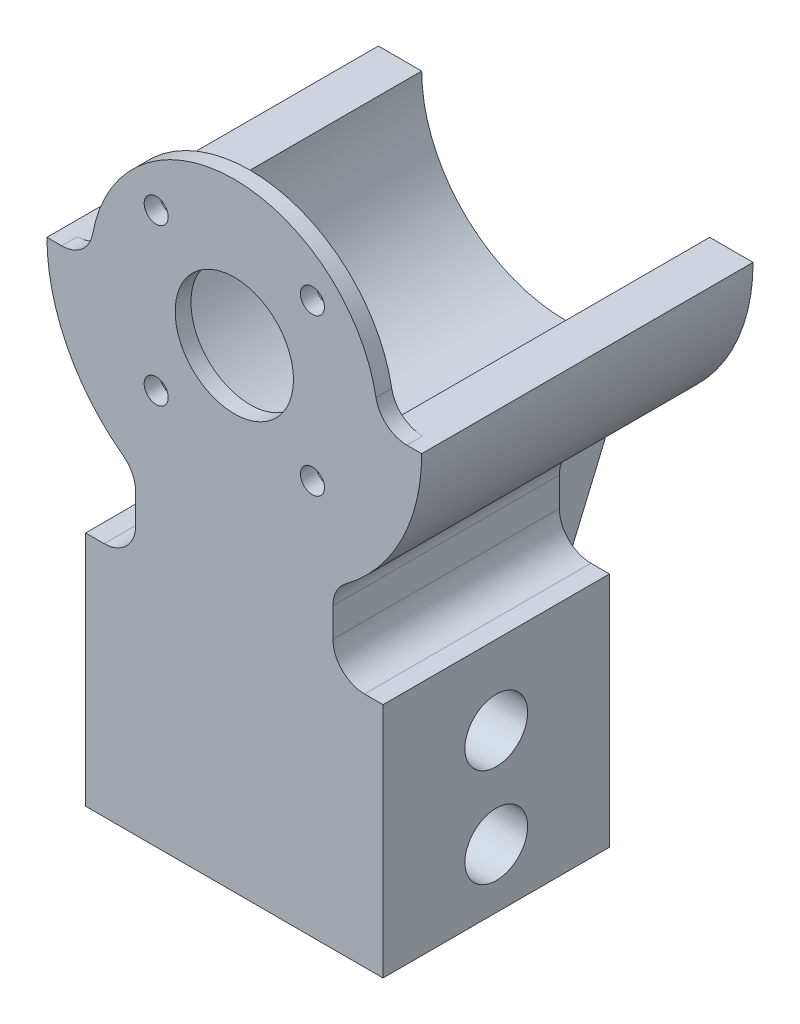
from build123d import *

# Parameters (mm, degrees)
SKETCH2_R               = 1.525
SKETCH2_R_2             = 7.5
BOSS_EXTRUDE3_DEPTH     = 2
BOSS_EXTRUDE4_START     = -40
BOSS_EXTRUDE4_DEPTH     = 42
BOSS_EXTRUDE6_START     = -30
SKETCH7_W               = 37.7
SKETCH7_H               = 28.7
SKETCH7_R               = 9.4
BOSS_EXTRUDE6_DEPTH     = 30
BOSS_EXTRUDE7_START     = -26.7
BOSS_EXTRUDE7_DEPTH     = 26.7
CUT_EXTRUDE1_DEPTH      = 76.921423195
CUT_EXTRUDE1_DEPTH_BACK = 76.921423195
SKETCH6_R               = 3.975
RIB3_START              = -5
RIB3_DEPTH              = 10
FILLET2_R               = 4


# Read off the part's stored shape, not the designer's step: Rib3
with BuildPart() as part:
    # Sketch2 → Boss-Extrude3 (new body)
    with BuildSketch(Plane.XY):
        with BuildLine():
            Line((12.5, -30), (12.5, -13.297086147))
            ThreePointArc((12.5, -13.297086147), (0, 18.25), (-12.5, -13.297086147))
            Line((-12.5, -13.297086147), (-12.5, -30))
            Line((-12.5, -30), (12.5, -30))
        make_face()
        with Locations((9.899494937, -9.899494937)):
            Circle(SKETCH2_R, mode=Mode.SUBTRACT)
        with Locations((-9.899494937, -9.899494937)):
            Circle(SKETCH2_R, mode=Mode.SUBTRACT)
        with Locations((-9.899494937, 9.899494937)):
            Circle(SKETCH2_R, mode=Mode.SUBTRACT)
        with Locations((9.899494937, 9.899494937)):
            Circle(SKETCH2_R, mode=Mode.SUBTRACT)
        Circle(SKETCH2_R_2, mode=Mode.SUBTRACT)
    extrude(amount=BOSS_EXTRUDE3_DEPTH)

    # Sketch3 → Boss-Extrude4 (add)
    with BuildSketch(Plane.XY.offset(BOSS_EXTRUDE4_START)):
        with BuildLine():
            Line((23.75, 0), (18.25, 0))
            ThreePointArc((18.25, 0), (0, -18.25), (-18.25, 0))
            Line((-18.25, 0), (-23.75, 0))
            ThreePointArc((-23.75, 0), (0, -23.75), (23.75, 0))
        make_face()
    extrude(amount=BOSS_EXTRUDE4_DEPTH)

    # Sketch7 → Boss-Extrude6 (add)
    with BuildSketch(Plane(origin=(0, 0, 0), x_dir=(1, 0, 0), z_dir=(0, 1, 0)).offset(BOSS_EXTRUDE6_START)):
        with Locations((0, 12.35)):
            Rectangle(SKETCH7_W, SKETCH7_H)
        with Locations(Location((0, 12.35, 0), (0, 0, 180))):
            Circle(SKETCH7_R, mode=Mode.SUBTRACT)
    extrude(amount=-BOSS_EXTRUDE6_DEPTH)

    # Sketch2<8> → Boss-Extrude7 (add)
    with BuildSketch(Plane.XY.offset(BOSS_EXTRUDE7_START)):
        with BuildLine():
            Line((12.5, -30), (12.5, -13.297086147))
            ThreePointArc((12.5, -13.297086147), (0, -18.25), (-12.5, -13.297086147))
            Line((-12.5, -13.297086147), (-12.5, -30))
            Line((-12.5, -30), (12.5, -30))
        make_face()
    extrude(amount=BOSS_EXTRUDE7_DEPTH)

    # Sketch6 → Cut-Extrude1 (cut, two sides: drawn at the far end of the back side and taken through both)
    with BuildSketch(Plane(origin=(0, 0, 0), x_dir=(0, 0, -1), z_dir=(1, 0, 0)).offset(-CUT_EXTRUDE1_DEPTH_BACK)):
        with Locations((12.35, -40)):
            Circle(SKETCH6_R)
        with Locations((12.35, -52.5)):
            Circle(SKETCH6_R)
    extrude(amount=CUT_EXTRUDE1_DEPTH + CUT_EXTRUDE1_DEPTH_BACK, mode=Mode.SUBTRACT)

    # Rib3 outline → Rib3 (add)
    with BuildSketch(Plane(origin=(0, -60, 0), x_dir=(0, -1, 0), z_dir=(-1, 0, 0)).offset(RIB3_START)):
        Polygon((-38, -40), (-31.25, -40), (0, -26.7), (-38, -26.7), align=None)
    extrude(amount=RIB3_DEPTH)

    # Fillet2
    fillet2_edges = [part.edges().sort_by_distance(p)[0] for p in [
        (12.5, -30, -12.35),
        (-12.5, -30, -12.35),
        (-18.25, 0, 1),
        (12.5, -20.194368027, -12.35),
        (18.25, 0, 1),
        (-12.5, -20.194368027, -12.35),
    ]]
    fillet(fillet2_edges, radius=FILLET2_R)


solid = part.part
